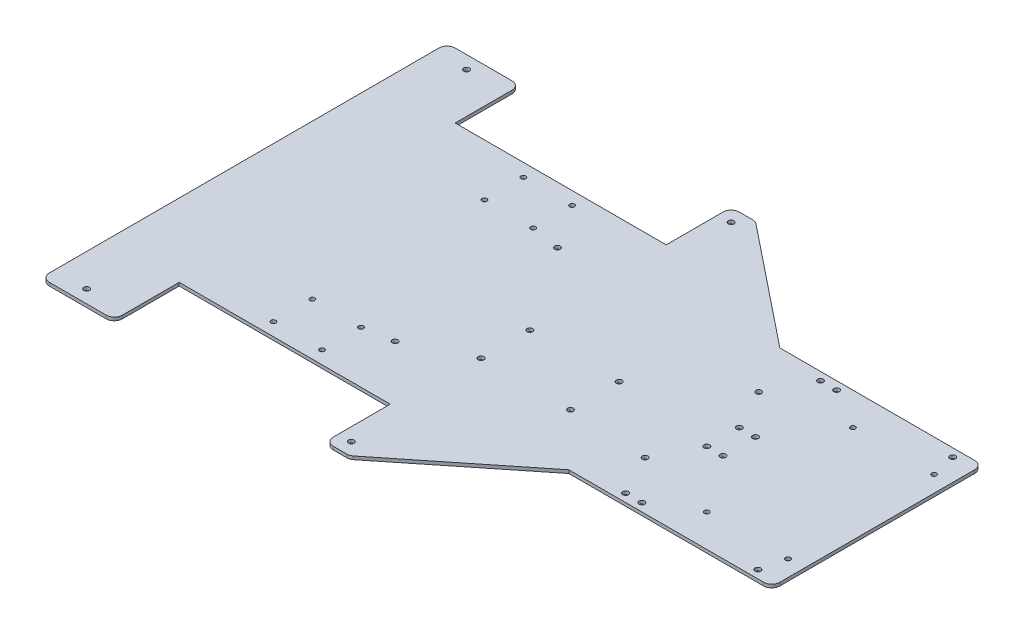
from build123d import *

# Parameters (mm, degrees)
SKETCH_1_W          = 390
SKETCH_1_H          = 250
EXTRUDE_1_DEPTH     = 2
SKETCH_2_W          = 130
SKETCH_2_H          = 40
SKETCH_2_W_2        = 125
SKETCH_2_H_2        = 60
CUT_EXTRUDE_1_DEPTH = 5
CUT_EXTRUDE_2_DEPTH = 10
FILLET_1_R          = 5
SKETCH_4_R          = 1.5
SKETCH_4_R_2        = 1.75
CUT_EXTRUDE_3_DEPTH = 232.633330935
SKETCH_5_R          = 1.75
CUT_EXTRUDE_4_DEPTH = 232.633330935
SKETCH_6_R          = 1.5
CUT_EXTRUDE_5_DEPTH = 232.633330935
SKETCH_7_R          = 1.75
CUT_EXTRUDE_6_DEPTH = 232.633330935


with BuildPart() as part:
    # 스케치1 → 보스-돌출1 (new body)
    with BuildSketch(Plane(origin=(0, 0, 0), x_dir=(1, 0, 0), z_dir=(0, 1, 0))):
        Rectangle(SKETCH_1_W, SKETCH_1_H)
    extrude(amount=EXTRUDE_1_DEPTH)

    # 스케치2 → 컷-돌출1 (cut)
    with BuildSketch(Plane(origin=(0, 2, 0), x_dir=(1, 0, 0), z_dir=(0, 1, 0))):
        with Locations((-85, 105)):
            Rectangle(SKETCH_2_W, SKETCH_2_H)
        with Locations((-85, -105)):
            Rectangle(SKETCH_2_W, SKETCH_2_H)
        with Locations((132.5, 95)):
            Rectangle(SKETCH_2_W_2, SKETCH_2_H_2)
        with Locations((132.5, -95)):
            Rectangle(SKETCH_2_W_2, SKETCH_2_H_2)
    extrude(amount=-CUT_EXTRUDE_1_DEPTH, mode=Mode.SUBTRACT)

    # 스케치3 → 컷-돌출2 (cut)
    with BuildSketch(Plane(origin=(0, 2, 0), x_dir=(1, 0, 0), z_dir=(0, 1, 0))):
        Polygon((-5, 125), (70, 65), (70, 125), align=None)
        Polygon((70, -65), (-5, -125), (70, -125), align=None)
    extrude(amount=-CUT_EXTRUDE_2_DEPTH, mode=Mode.SUBTRACT)

    # 필렛1
    fillet_1_edges = [part.edges().sort_by_distance(p)[0] for p in [
        (-20, 1, 125),
        (-20, 1, -125),
        (-5, 1, 125),
        (-5, 1, -125),
        (195, 1, -65),
        (195, 1, 65),
        (-195, 1, -125),
        (-195, 1, 125),
        (-150, 1, -125),
        (-150, 1, 125),
    ]]
    fillet(fillet_1_edges, radius=FILLET_1_R)

    # 스케치4 → 컷-돌출3 (cut, through all)
    with BuildSketch(Plane(origin=(0, 2, 0), x_dir=(1, 0, 0), z_dir=(0, 1, 0))):
        with Locations((-100, 77)):
            Circle(SKETCH_4_R)
        with Locations((-70, 77)):
            Circle(SKETCH_4_R)
        with Locations((-70, 53)):
            Circle(SKETCH_4_R)
        with Locations((-100, 53)):
            Circle(SKETCH_4_R)
        with Locations((-100, -53)):
            Circle(SKETCH_4_R)
        with Locations((-70, -53)):
            Circle(SKETCH_4_R)
        with Locations((-70, -77)):
            Circle(SKETCH_4_R)
        with Locations((-100, -77)):
            Circle(SKETCH_4_R)
        with Locations((100, 60)):
            Circle(SKETCH_4_R_2)
        with Locations((110, 60)):
            Circle(SKETCH_4_R_2)
        with Locations((100, 10)):
            Circle(SKETCH_4_R_2)
        with Locations((110, 10)):
            Circle(SKETCH_4_R_2)
        with Locations((100, -10)):
            Circle(SKETCH_4_R_2)
        with Locations((110, -10)):
            Circle(SKETCH_4_R_2)
        with Locations((100, -60)):
            Circle(SKETCH_4_R_2)
        with Locations((110, -60)):
            Circle(SKETCH_4_R_2)
    extrude(amount=-CUT_EXTRUDE_3_DEPTH, mode=Mode.SUBTRACT)

    # 스케치5 → 컷-돌출4 (cut, through all)
    with BuildSketch(Plane(origin=(0, 2, 0), x_dir=(1, 0, 0), z_dir=(0, 1, 0))):
        with Locations((-16.5, -2.5)):
            Circle(SKETCH_5_R)
        with Locations((38.5, -2.5)):
            Circle(SKETCH_5_R)
        with Locations((-16.5, -32.5)):
            Circle(SKETCH_5_R)
        with Locations((38.5, -32.5)):
            Circle(SKETCH_5_R)
    extrude(amount=-CUT_EXTRUDE_4_DEPTH, mode=Mode.SUBTRACT)

    # 스케치6 → 컷-돌출5 (cut, through all)
    with BuildSketch(Plane(origin=(0, 2, 0), x_dir=(1, 0, 0), z_dir=(0, 1, 0))):
        with Locations((135, 45)):
            Circle(SKETCH_6_R)
        with Locations((185, 45)):
            Circle(SKETCH_6_R)
        with Locations((135, -45)):
            Circle(SKETCH_6_R)
        with Locations((185, -45)):
            Circle(SKETCH_6_R)
    extrude(amount=-CUT_EXTRUDE_5_DEPTH, mode=Mode.SUBTRACT)

    # 스케치7 → 컷-돌출6 (cut, through all)
    with BuildSketch(Plane(origin=(0, 2, 0), x_dir=(1, 0, 0), z_dir=(0, 1, 0))):
        with Locations((-12, 117)):
            Circle(SKETCH_7_R)
        with Locations((-12, -117)):
            Circle(SKETCH_7_R)
        with Locations((181.5, 60)):
            Circle(SKETCH_7_R)
        with Locations((181.5, -60)):
            Circle(SKETCH_7_R)
        with Locations((-175, 117)):
            Circle(SKETCH_7_R)
        with Locations((-175, -117)):
            Circle(SKETCH_7_R)
        with Locations((87, 35)):
            Circle(SKETCH_7_R)
        with Locations((87, -35)):
            Circle(SKETCH_7_R)
        with Locations((-52, 50)):
            Circle(SKETCH_7_R)
        with Locations((-52, -50)):
            Circle(SKETCH_7_R)
    extrude(amount=-CUT_EXTRUDE_6_DEPTH, mode=Mode.SUBTRACT)


solid = part.part
